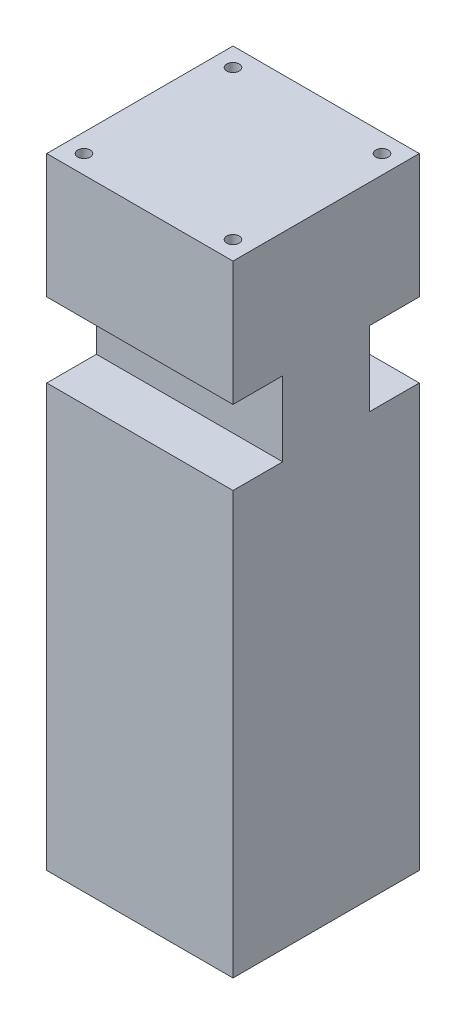
from build123d import *

# Parameters (mm, degrees)
SKETCH2_W           = 150
SKETCH2_H           = 150
BOSS_EXTRUDE1_DEPTH = 500
SKETCH4_W           = 40
SKETCH4_H           = 60
CUT_EXTRUDE1_DEPTH  = 544.13902456
SKETCH5_R           = 5
CUT_EXTRUDE2_DEPTH  = 150


with BuildPart() as part:
    # Sketch2 → Boss-Extrude1 (new body)
    with BuildSketch(Plane(origin=(0, 0, 0), x_dir=(1, 0, 0), z_dir=(0, 1, 0))):
        with Locations((75, 75)):
            Rectangle(SKETCH2_W, SKETCH2_H)
    extrude(amount=BOSS_EXTRUDE1_DEPTH)

    # Sketch4 → Cut-Extrude1 (cut, symmetric)
    with BuildSketch(Plane(origin=(150, 0, 0), x_dir=(0, 0, -1), z_dir=(1, 0, 0))):
        with Locations((20, 370)):
            Rectangle(SKETCH4_W, SKETCH4_H)
    cut_extrude1 = extrude(amount=CUT_EXTRUDE1_DEPTH, both=True, mode=Mode.SUBTRACT)

    # Sketch5 → Cut-Extrude2 (cut)
    with BuildSketch(Plane(origin=(0, 500, 0), x_dir=(1, 0, 0), z_dir=(0, 1, 0))):
        with Locations((15, 15)):
            Circle(SKETCH5_R)
        with Locations((135, 15)):
            Circle(SKETCH5_R)
    cut_extrude2 = extrude(amount=-CUT_EXTRUDE2_DEPTH, mode=Mode.SUBTRACT)

    # Mirror2: Cut-Extrude1, Cut-Extrude2 across plane
    add(cut_extrude1.mirror(Plane(origin=(0, 0, -75), x_dir=(1, 0, 0), z_dir=(0, 0, -1))), mode=Mode.SUBTRACT)
    add(cut_extrude2.mirror(Plane(origin=(0, 0, -75), x_dir=(1, 0, 0), z_dir=(0, 0, -1))), mode=Mode.SUBTRACT)


solid = part.part
